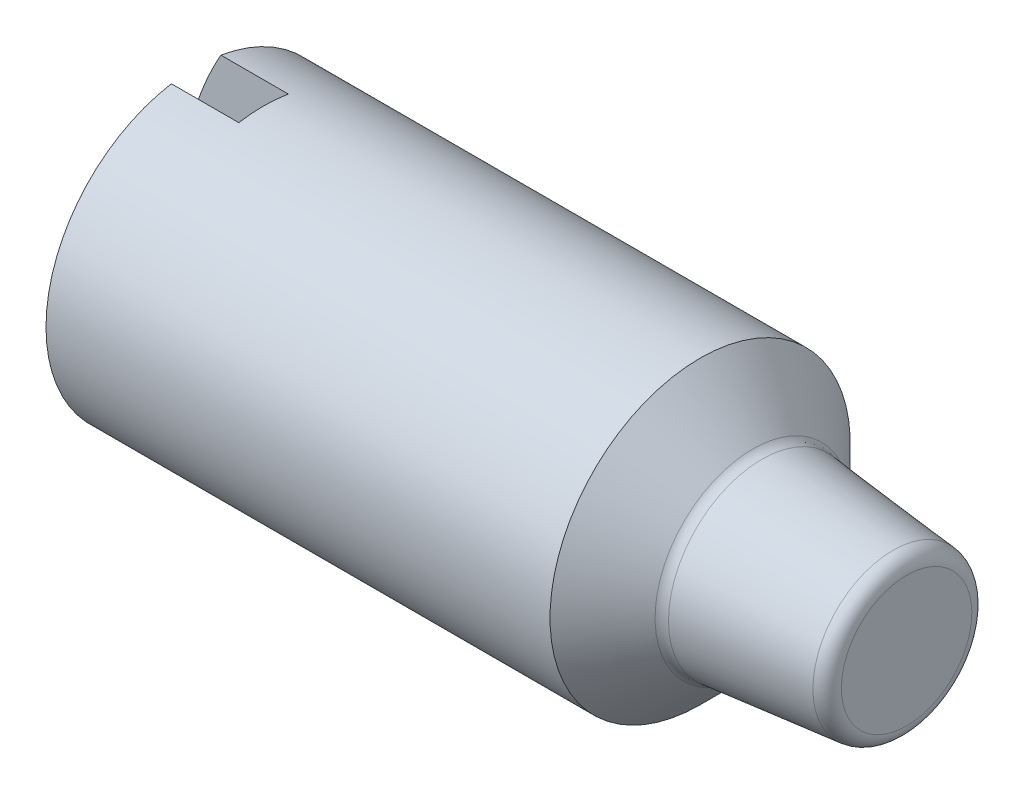
from build123d import *

# Parameters (mm, degrees)
NOTCH_DEPTH      = 11.392304845
NOTCH_DEPTH_BACK = 11.392304845
FILLET_2_R       = 0.2


with BuildPart() as part:
    # Sketch1 → Base (revolve)
    with BuildSketch(Plane.XY):
        with BuildLine():
            Line((10, 0), (0, 0))
            ThreePointArc((0, 0), (0.136296695, 1.03527618), (0.535898385, 2))
            Line((0.535898385, 2), (7.25, 2))
            Line((7.25, 2), (8, 1.25))
            Line((8, 1.25), (10, 1.05))
            Line((10, 1.05), (10, 0))
        make_face()
    revolve(axis=Axis((-8.57033571, 0, 0), (1, 0, 0)))

    # Sketch2 → Notch (cut, two sides: drawn at the far end of the back side and taken through both)
    with BuildSketch(Plane(origin=(0, 0, 0), x_dir=(1, 0, 0), z_dir=(0, 1, 0)).offset(-NOTCH_DEPTH_BACK)):
        with BuildLine():
            Line((1.433635742, 0.33), (0.013635742, 0.33))
            ThreePointArc((0.013635742, 0.33), (-0.316364258, 0), (0.013635742, -0.33))
            Line((0.013635742, -0.33), (1.433635742, -0.33))
            Line((1.433635742, -0.33), (1.433635742, 0.33))
        make_face()
    extrude(amount=NOTCH_DEPTH + NOTCH_DEPTH_BACK, mode=Mode.SUBTRACT)

    # Fillet 2
    fillet_2_edges = [part.edges().sort_by_distance(p)[0] for p in [
        (10, -1.05, 0),
        (8, -1.25, 0),
    ]]
    fillet(fillet_2_edges, radius=FILLET_2_R)


solid = part.part
